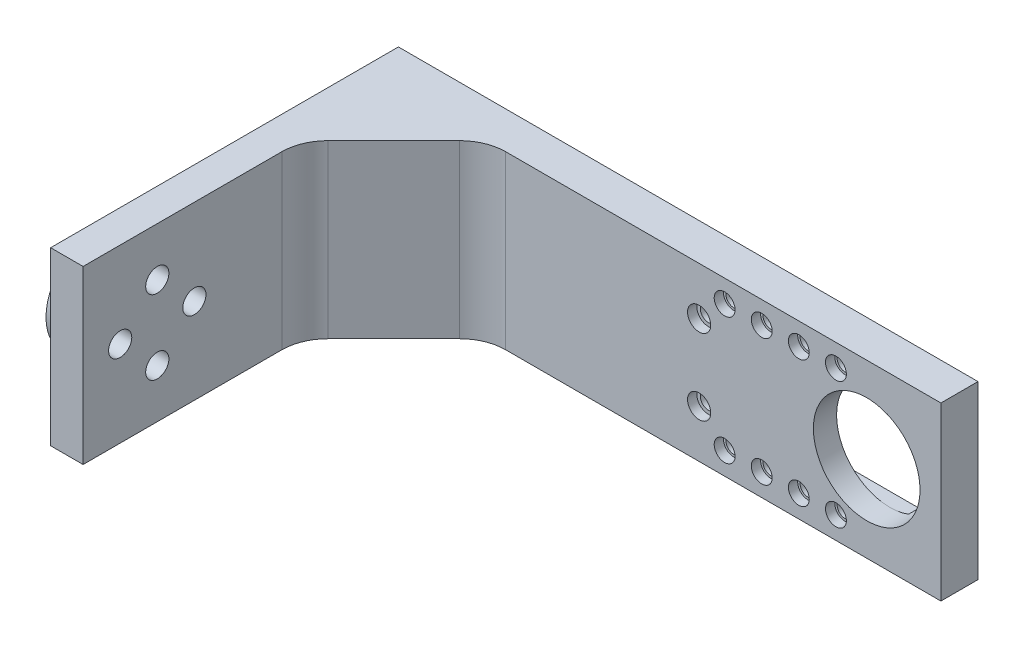
from build123d import *

# Parameters (mm, degrees)
BOSS_EXTRUDE1_DEPTH = 37
CUT_EXTRUDE1_REACH  = 152.396
CUT_EXTRUDE2_REACH  = 152.396
SKETCH3_R           = 1.75
CUT_EXTRUDE5_REACH  = 152.396
SKETCH5_R           = 1.75
BOSS_EXTRUDE3_START = 6
SKETCH6_R           = 11
SKETCH6_R_2         = 1.75
BOSS_EXTRUDE3_DEPTH = 6
SKETCH4_W           = 38
SKETCH4_H           = 23
CUT_EXTRUDE6_DEPTH  = 3
SKETCH7_W           = 3
SKETCH7_H           = 23
BOSS_EXTRUDE4_DEPTH = 7.5
SKETCH9_R           = 2.25
CUT_EXTRUDE8_DEPTH  = 2
SKETCH10_R          = 2.5
CUT_EXTRUDE9_DEPTH  = 5
CHAMFER1_SIZE       = 20
FILLET5_R           = 10
CUT_EXTRUDE10_REACH = 148.571
SKETCH11_R          = 1.75
SKETCH12_R          = 2.5
CUT_EXTRUDE11_DEPTH = 2


with BuildPart() as part:
    # Sketch1 → Boss-Extrude1 (new body)
    with BuildSketch(Plane(origin=(0, 0, 0), x_dir=(1, 0, 0), z_dir=(0, 1, 0))):
        Polygon((0, 0), (0, 75), (125, 75), (125, 67), (7, 67), (7, 0), align=None)
    extrude(amount=BOSS_EXTRUDE1_DEPTH)

    # Sketch2 → Cut-Extrude1 (cut, up to next)
    with BuildSketch(Plane(origin=(0, 0, -75), x_dir=(-1, 0, 0), z_dir=(0, 0, -1)), mode=Mode.PRIVATE) as cut_extrude1_sk1:
        with BuildLine():
            ThreePointArc((-120.5, 18.5), (-109, 7), (-97.5, 18.5))
            ThreePointArc((-97.5, 18.5), (-109, 30), (-120.5, 18.5))
        make_face()
    cut_extrude1_tool1 = extrude(cut_extrude1_sk1.sketch, amount=-CUT_EXTRUDE1_REACH, mode=Mode.PRIVATE) & part.part
    add(cut_extrude1_tool1.solids().sort_by_distance((109, 18.5, -75))[0], mode=Mode.SUBTRACT)

    # Sketch3 → Cut-Extrude2 (cut, up to next)
    with BuildSketch(Plane(origin=(0, 0, -75), x_dir=(-1, 0, 0), z_dir=(0, 0, -1)), mode=Mode.PRIVATE) as cut_extrude2_sk1:
        with Locations((-102.36, 32.19)):
            Circle(SKETCH3_R)
    cut_extrude2_tool1 = extrude(cut_extrude2_sk1.sketch, amount=-CUT_EXTRUDE2_REACH, mode=Mode.PRIVATE) & part.part
    # Sketch3 → Cut-Extrude2 (cut, up to next)
    with BuildSketch(Plane(origin=(0, 0, -75), x_dir=(-1, 0, 0), z_dir=(0, 0, -1)), mode=Mode.PRIVATE) as cut_extrude2_sk2:
        with Locations((-94.36, 32.19)):
            Circle(SKETCH3_R)
    cut_extrude2_tool2 = extrude(cut_extrude2_sk2.sketch, amount=-CUT_EXTRUDE2_REACH, mode=Mode.PRIVATE) & part.part
    # Sketch3 → Cut-Extrude2 (cut, up to next)
    with BuildSketch(Plane(origin=(0, 0, -75), x_dir=(-1, 0, 0), z_dir=(0, 0, -1)), mode=Mode.PRIVATE) as cut_extrude2_sk3:
        with Locations((-86.36, 32.19)):
            Circle(SKETCH3_R)
    cut_extrude2_tool3 = extrude(cut_extrude2_sk3.sketch, amount=-CUT_EXTRUDE2_REACH, mode=Mode.PRIVATE) & part.part
    # Sketch3 → Cut-Extrude2 (cut, up to next)
    with BuildSketch(Plane(origin=(0, 0, -75), x_dir=(-1, 0, 0), z_dir=(0, 0, -1)), mode=Mode.PRIVATE) as cut_extrude2_sk4:
        with Locations((-78.36, 32.19)):
            Circle(SKETCH3_R)
    cut_extrude2_tool4 = extrude(cut_extrude2_sk4.sketch, amount=-CUT_EXTRUDE2_REACH, mode=Mode.PRIVATE) & part.part
    # Sketch3 → Cut-Extrude2 (cut, up to next)
    with BuildSketch(Plane(origin=(0, 0, -75), x_dir=(-1, 0, 0), z_dir=(0, 0, -1)), mode=Mode.PRIVATE) as cut_extrude2_sk5:
        with Locations((-78.36, 4.81)):
            Circle(SKETCH3_R)
    cut_extrude2_tool5 = extrude(cut_extrude2_sk5.sketch, amount=-CUT_EXTRUDE2_REACH, mode=Mode.PRIVATE) & part.part
    # Sketch3 → Cut-Extrude2 (cut, up to next)
    with BuildSketch(Plane(origin=(0, 0, -75), x_dir=(-1, 0, 0), z_dir=(0, 0, -1)), mode=Mode.PRIVATE) as cut_extrude2_sk6:
        with Locations((-86.36, 4.81)):
            Circle(SKETCH3_R)
    cut_extrude2_tool6 = extrude(cut_extrude2_sk6.sketch, amount=-CUT_EXTRUDE2_REACH, mode=Mode.PRIVATE) & part.part
    # Sketch3 → Cut-Extrude2 (cut, up to next)
    with BuildSketch(Plane(origin=(0, 0, -75), x_dir=(-1, 0, 0), z_dir=(0, 0, -1)), mode=Mode.PRIVATE) as cut_extrude2_sk7:
        with Locations((-94.36, 4.81)):
            Circle(SKETCH3_R)
    cut_extrude2_tool7 = extrude(cut_extrude2_sk7.sketch, amount=-CUT_EXTRUDE2_REACH, mode=Mode.PRIVATE) & part.part
    # Sketch3 → Cut-Extrude2 (cut, up to next)
    with BuildSketch(Plane(origin=(0, 0, -75), x_dir=(-1, 0, 0), z_dir=(0, 0, -1)), mode=Mode.PRIVATE) as cut_extrude2_sk8:
        with Locations((-102.36, 4.81)):
            Circle(SKETCH3_R)
    cut_extrude2_tool8 = extrude(cut_extrude2_sk8.sketch, amount=-CUT_EXTRUDE2_REACH, mode=Mode.PRIVATE) & part.part
    add(cut_extrude2_tool1.solids().sort_by_distance((102.36, 32.19, -75))[0], mode=Mode.SUBTRACT)
    add(cut_extrude2_tool2.solids().sort_by_distance((94.36, 32.19, -75))[0], mode=Mode.SUBTRACT)
    add(cut_extrude2_tool3.solids().sort_by_distance((86.36, 32.19, -75))[0], mode=Mode.SUBTRACT)
    add(cut_extrude2_tool4.solids().sort_by_distance((78.36, 32.19, -75))[0], mode=Mode.SUBTRACT)
    add(cut_extrude2_tool5.solids().sort_by_distance((78.36, 4.81, -75))[0], mode=Mode.SUBTRACT)
    add(cut_extrude2_tool6.solids().sort_by_distance((86.36, 4.81, -75))[0], mode=Mode.SUBTRACT)
    add(cut_extrude2_tool7.solids().sort_by_distance((94.36, 4.81, -75))[0], mode=Mode.SUBTRACT)
    add(cut_extrude2_tool8.solids().sort_by_distance((102.36, 4.81, -75))[0], mode=Mode.SUBTRACT)

    # Sketch5 → Cut-Extrude5 (cut, up to next)
    with BuildSketch(Plane.ZY, mode=Mode.PRIVATE) as cut_extrude5_sk1:
        with Locations((-16, 10.5)):
            Circle(SKETCH5_R)
    cut_extrude5_tool1 = extrude(cut_extrude5_sk1.sketch, amount=-CUT_EXTRUDE5_REACH, mode=Mode.PRIVATE) & part.part
    # Sketch5 → Cut-Extrude5 (cut, up to next)
    with BuildSketch(Plane.ZY, mode=Mode.PRIVATE) as cut_extrude5_sk2:
        with Locations((-24, 18.5)):
            Circle(SKETCH5_R)
    cut_extrude5_tool2 = extrude(cut_extrude5_sk2.sketch, amount=-CUT_EXTRUDE5_REACH, mode=Mode.PRIVATE) & part.part
    # Sketch5 → Cut-Extrude5 (cut, up to next)
    with BuildSketch(Plane.ZY, mode=Mode.PRIVATE) as cut_extrude5_sk3:
        with Locations((-16, 26.5)):
            Circle(SKETCH5_R)
    cut_extrude5_tool3 = extrude(cut_extrude5_sk3.sketch, amount=-CUT_EXTRUDE5_REACH, mode=Mode.PRIVATE) & part.part
    # Sketch5 → Cut-Extrude5 (cut, up to next)
    with BuildSketch(Plane.ZY, mode=Mode.PRIVATE) as cut_extrude5_sk4:
        with Locations((-8, 18.5)):
            Circle(SKETCH5_R)
    cut_extrude5_tool4 = extrude(cut_extrude5_sk4.sketch, amount=-CUT_EXTRUDE5_REACH, mode=Mode.PRIVATE) & part.part
    add(cut_extrude5_tool1.solids().sort_by_distance((0, 10.5, -16))[0], mode=Mode.SUBTRACT)
    add(cut_extrude5_tool2.solids().sort_by_distance((0, 18.5, -24))[0], mode=Mode.SUBTRACT)
    add(cut_extrude5_tool3.solids().sort_by_distance((0, 26.5, -16))[0], mode=Mode.SUBTRACT)
    add(cut_extrude5_tool4.solids().sort_by_distance((0, 18.5, -8))[0], mode=Mode.SUBTRACT)

    # Sketch6 → Boss-Extrude3 (add)
    with BuildSketch(Plane.ZY.offset(BOSS_EXTRUDE3_START)):
        with Locations((-16, 18.5)):
            Circle(SKETCH6_R)
        with Locations((-16, 10.5)):
            Circle(SKETCH6_R_2, mode=Mode.SUBTRACT)
        with BuildLine():
            ThreePointArc((-9.75, 18.5), (-8, 20.25), (-6.25, 18.5))
            ThreePointArc((-6.25, 18.5), (-8, 16.75), (-9.75, 18.5))
        make_face(mode=Mode.SUBTRACT)
        with Locations((-24, 18.5)):
            Circle(SKETCH6_R_2, mode=Mode.SUBTRACT)
        with Locations((-16, 26.5)):
            Circle(SKETCH6_R_2, mode=Mode.SUBTRACT)
    extrude(amount=-BOSS_EXTRUDE3_DEPTH)

    # Sketch4 → Cut-Extrude6 (cut)
    with BuildSketch(Plane(origin=(0, 0, -75), x_dir=(-1, 0, 0), z_dir=(0, 0, -1))):
        with Locations((-94, 18.5)):
            Rectangle(SKETCH4_W, SKETCH4_H)
    extrude(amount=-CUT_EXTRUDE6_DEPTH, mode=Mode.SUBTRACT)

    # Sketch7 → Boss-Extrude4 (add)
    with BuildSketch(Plane(origin=(75, 0, 0), x_dir=(0, 0, -1), z_dir=(1, 0, 0))):
        with Locations((73.5, 18.5)):
            Rectangle(SKETCH7_W, SKETCH7_H)
    extrude(amount=BOSS_EXTRUDE4_DEPTH)

    # Sketch9 → Cut-Extrude8 (cut)
    with BuildSketch(Plane.XY.offset(-67)):
        with Locations((78.36, 32.19)):
            Circle(SKETCH9_R)
        with Locations((86.36, 32.19)):
            Circle(SKETCH9_R)
        with Locations((94.36, 32.19)):
            Circle(SKETCH9_R)
        with Locations((102.36, 32.19)):
            Circle(SKETCH9_R)
        with Locations((78.36, 4.81)):
            Circle(SKETCH9_R)
        with Locations((86.36, 4.81)):
            Circle(SKETCH9_R)
        with Locations((94.36, 4.81)):
            Circle(SKETCH9_R)
        with Locations((102.36, 4.81)):
            Circle(SKETCH9_R)
    extrude(amount=-CUT_EXTRUDE8_DEPTH, mode=Mode.SUBTRACT)

    # Sketch10 → Cut-Extrude9 (cut)
    with BuildSketch(Plane(origin=(7, 0, 0), x_dir=(0, 0, -1), z_dir=(1, 0, 0))):
        with Locations((24, 18.5)):
            Circle(SKETCH10_R)
        with Locations((16, 10.5)):
            Circle(SKETCH10_R)
        with Locations((8, 18.5)):
            Circle(SKETCH10_R)
        with Locations((16, 26.5)):
            Circle(SKETCH10_R)
    extrude(amount=-CUT_EXTRUDE9_DEPTH, mode=Mode.SUBTRACT)

    # Chamfer1
    chamfer1_edges = [part.edges().sort_by_distance(p)[0] for p in [
        (7, 18.5, -67),
    ]]
    chamfer(chamfer1_edges, length=CHAMFER1_SIZE)

    # Fillet5
    fillet5_edges = [part.edges().sort_by_distance(p)[0] for p in [
        (7, 18.5, -47),
        (27, 18.5, -67),
    ]]
    fillet(fillet5_edges, radius=FILLET5_R)

    # Sketch11 → Cut-Extrude10 (cut, up to next)
    with BuildSketch(Plane.XY.offset(-67), mode=Mode.PRIVATE) as cut_extrude10_sk1:
        with Locations((72.86, 10.31)):
            Circle(SKETCH11_R)
    cut_extrude10_tool1 = extrude(cut_extrude10_sk1.sketch, amount=-CUT_EXTRUDE10_REACH, mode=Mode.PRIVATE) & part.part
    # Sketch11 → Cut-Extrude10 (cut, up to next)
    with BuildSketch(Plane.XY.offset(-67), mode=Mode.PRIVATE) as cut_extrude10_sk2:
        with Locations((72.86, 26.69)):
            Circle(SKETCH11_R)
    cut_extrude10_tool2 = extrude(cut_extrude10_sk2.sketch, amount=-CUT_EXTRUDE10_REACH, mode=Mode.PRIVATE) & part.part
    add(cut_extrude10_tool1.solids().sort_by_distance((72.86, 10.31, -67))[0], mode=Mode.SUBTRACT)
    add(cut_extrude10_tool2.solids().sort_by_distance((72.86, 26.69, -67))[0], mode=Mode.SUBTRACT)

    # Sketch12 → Cut-Extrude11 (cut)
    with BuildSketch(Plane.XY.offset(-67)):
        with Locations((72.86, 10.31)):
            Circle(SKETCH12_R)
        with Locations((72.86, 26.69)):
            Circle(SKETCH12_R)
    extrude(amount=-CUT_EXTRUDE11_DEPTH, mode=Mode.SUBTRACT)


solid = part.part
